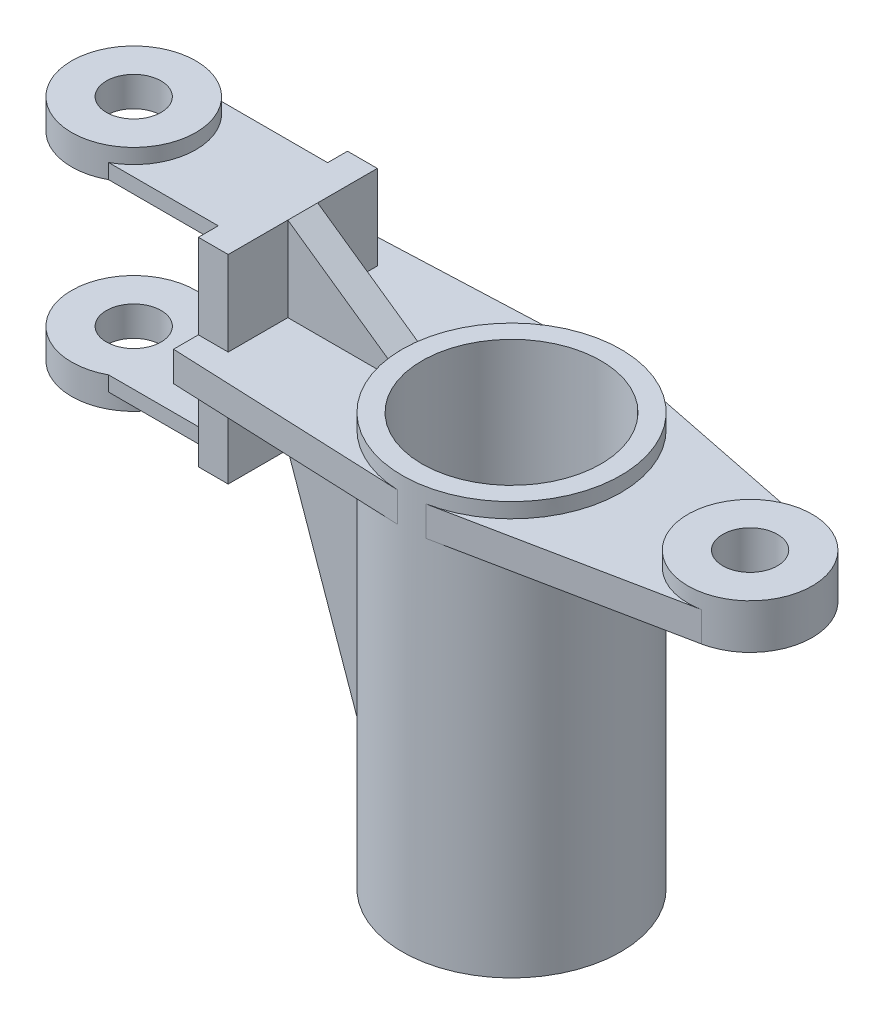
from build123d import *

# Parameters (mm, degrees)
SKETCH1_R            = 22
SKETCH1_R_2          = 18
BOSS_EXTRUDE1_DEPTH  = 83
BOSS_EXTRUDE2_START  = -9
SKETCH2_R            = 18
SKETCH2_R_2          = 5.5
BOSS_EXTRUDE2_DEPTH  = 6
SKETCH6_W            = 30
SKETCH6_H            = 40
BOSS_EXTRUDE5_DEPTH  = 6
BOSS_EXTRUDE6_START  = -3
SKETCH7_R            = 12.5
SKETCH7_R_2          = 5.5
BOSS_EXTRUDE6_DEPTH  = 6
BOSS_EXTRUDE7_DEPTH  = 3
BOSS_EXTRUDE8_START  = -6
SKETCH9_R            = 12.5
SKETCH9_R_2          = 5.5
BOSS_EXTRUDE8_DEPTH  = 6
RIB1_REACH           = 137.338
SKETCH10_WALL_W      = 297.088193202
SKETCH10_WALL_H      = 6
BOSS_EXTRUDE10_DEPTH = 3
SKETCH12_R           = 12.5
SKETCH12_R_2         = 5.5
BOSS_EXTRUDE11_DEPTH = 3


with BuildPart() as part:
    # Sketch1 → Boss-Extrude1 (new body)
    with BuildSketch(Plane(origin=(0, 0, 0), x_dir=(1, 0, 0), z_dir=(0, 1, 0))):
        Circle(SKETCH1_R)
        Circle(SKETCH1_R_2, mode=Mode.SUBTRACT)
    extrude(amount=BOSS_EXTRUDE1_DEPTH)

    # Sketch2 → Boss-Extrude2 (add)
    with BuildSketch(Plane(origin=(0, 83, 0), x_dir=(1, 0, 0), z_dir=(0, 1, 0)).offset(BOSS_EXTRUDE2_START)):
        with BuildLine():
            Line((-48, 20), (-48, -20))
            Line((-48, -20), (-0.924768705, -21.980555108))
            ThreePointArc((-0.924768705, -21.980555108), (1.727252911, -21.932090584), (4.354166667, -21.564814691))
            Line((4.354166667, -21.564814691), (50.473958333, -12.25273562))
            ThreePointArc((50.473958333, -12.25273562), (60.5, 0), (50.473958333, 12.25273562))
            Line((50.473958333, 12.25273562), (4.354166667, 21.564814691))
            ThreePointArc((4.354166667, 21.564814691), (1.727252911, 21.932090584), (-0.924768705, 21.980555108))
            Line((-0.924768705, 21.980555108), (-48, 20))
        make_face()
        Circle(SKETCH2_R, mode=Mode.SUBTRACT)
        with Locations((48, 0)):
            Circle(SKETCH2_R_2, mode=Mode.SUBTRACT)
    extrude(amount=BOSS_EXTRUDE2_DEPTH)

    # Sketch6 → Boss-Extrude5 (add)
    with BuildSketch(Plane.ZY.offset(48)):
        with Locations((0, 77)):
            Rectangle(SKETCH6_W, SKETCH6_H)
    extrude(amount=-BOSS_EXTRUDE5_DEPTH)



with BuildPart() as body_2:
    # Sketch7 → Boss-Extrude6 (new body)
    with BuildSketch(Plane(origin=(0, 97, 0), x_dir=(1, 0, 0), z_dir=(0, 1, 0)).offset(BOSS_EXTRUDE6_START)):
        with Locations((-76, 0)):
            Circle(SKETCH7_R)
        with Locations((-76, 0)):
            Circle(SKETCH7_R_2, mode=Mode.SUBTRACT)
    extrude(amount=BOSS_EXTRUDE6_DEPTH)


with BuildPart() as part_1:
    add(part.part)

    add(body_2.part)  # Boss-Extrude7 merges body 2
    # Sketch8 → Boss-Extrude7 (add)
    with BuildSketch(Plane(origin=(0, 97, 0), x_dir=(1, 0, 0), z_dir=(0, 1, 0))):
        with BuildLine():
            Line((-70.062828956, 11), (-48, 11))
            Line((-48, 11), (-48, -11))
            Line((-48, -11), (-70.062828956, -11))
            ThreePointArc((-70.062828956, -11), (-63.5, 0), (-70.062828956, 11))
        make_face()
    boss_extrude7 = extrude(amount=-BOSS_EXTRUDE7_DEPTH)

    # Mirror3: Boss-Extrude7 across plane
    add(boss_extrude7.mirror(Plane.ZX.offset(77)))

    # Sketch9 → Boss-Extrude8 (add)
    with BuildSketch(Plane(origin=(0, 60, 0), x_dir=(1, 0, 0), z_dir=(0, 1, 0)).offset(BOSS_EXTRUDE8_START)):
        with Locations((-76, 0)):
            Circle(SKETCH9_R)
        with Locations((-76, 0)):
            Circle(SKETCH9_R_2, mode=Mode.SUBTRACT)
    extrude(amount=BOSS_EXTRUDE8_DEPTH)

    # Sketch10 wall → Rib1 (add, up to next)
    with BuildSketch(Plane(origin=(-32, 90, 0), x_dir=(0.819231920519, -0.573462344363, 0), z_dir=(0.573462344363, 0.819231920519, 0)), mode=Mode.PRIVATE) as rib1_sk1:
        Rectangle(SKETCH10_WALL_W, SKETCH10_WALL_H)
    rib1_tool1 = extrude(rib1_sk1.sketch, amount=-RIB1_REACH, mode=Mode.PRIVATE) - part_1.part
    add(rib1_tool1.solids().sort_by_distance((-32, 90, 0))[0])

    # Sketch11 → Boss-Extrude10 (add, symmetric)
    with BuildSketch(Plane.XY):
        Polygon((-42, 57), (-22, 0), (-20, 0), (-20, 74), (-42, 74), align=None)
    extrude(amount=BOSS_EXTRUDE10_DEPTH, both=True)

    # Sketch12 → Boss-Extrude11 (add)
    with BuildSketch(Plane(origin=(0, 80, 0), x_dir=(1, 0, 0), z_dir=(0, 1, 0))):
        with Locations((48, 0)):
            Circle(SKETCH12_R)
        with Locations((48, 0)):
            Circle(SKETCH12_R_2, mode=Mode.SUBTRACT)
    extrude(amount=BOSS_EXTRUDE11_DEPTH)


solid = part_1.part
